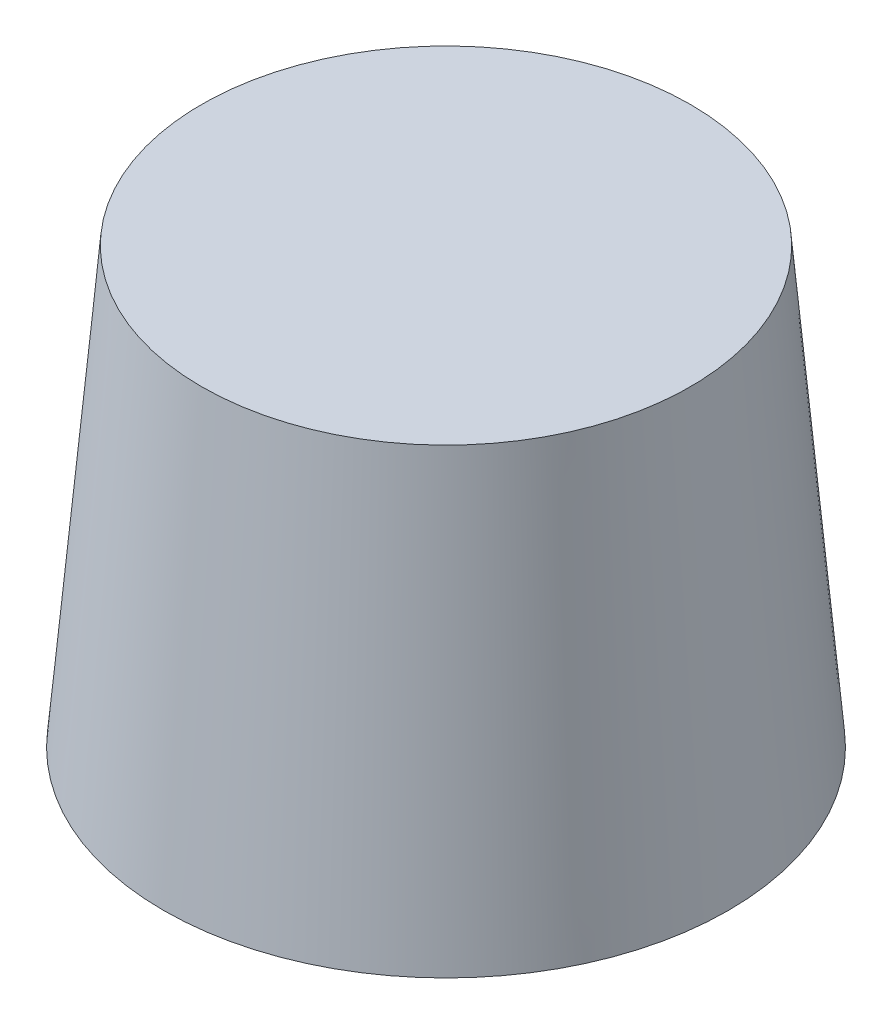
from build123d import *

# Parameters (mm, degrees)
SKETCH1_R  = 8.255
CONE_DEPTH = 12.7
CONE_TAPER = 5


with BuildPart() as part:
    # Sketch1 → cone (new body)
    with BuildSketch(Plane(origin=(0, 0, 0), x_dir=(1, 0, 0), z_dir=(0, 1, 0))):
        Circle(SKETCH1_R)
    extrude(amount=CONE_DEPTH, taper=CONE_TAPER)


solid = part.part
